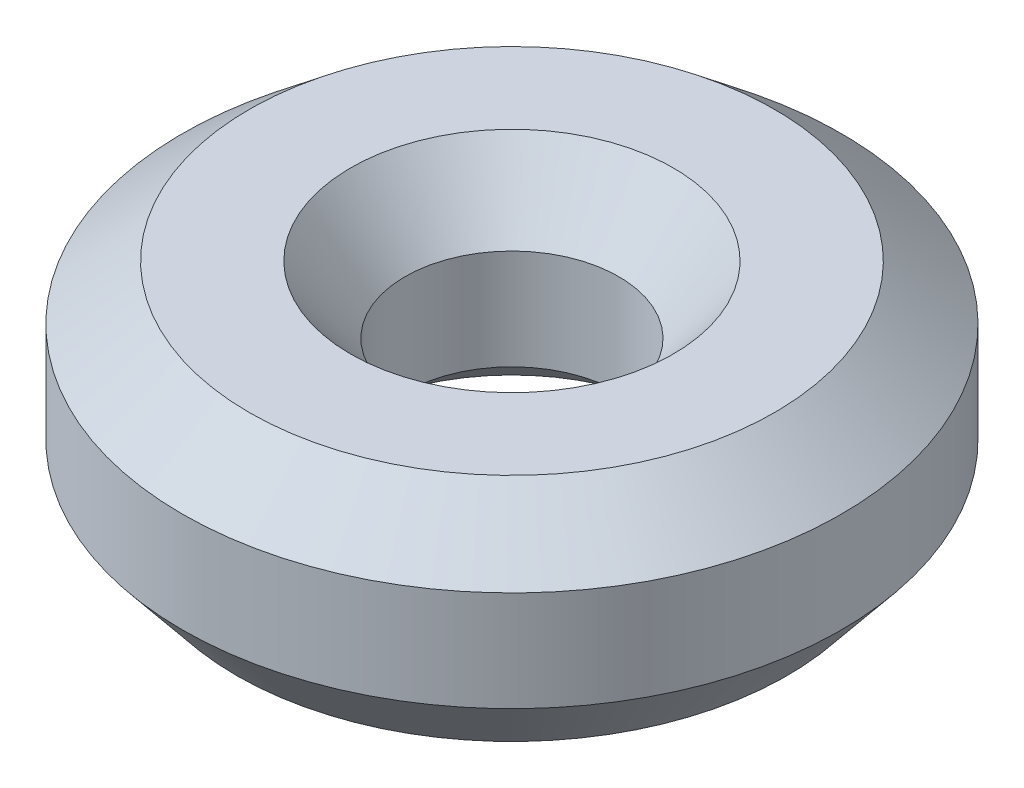
from build123d import *
from OCP.BRepFilletAPI import BRepFilletAPI_MakeChamfer

# Parameters (mm, degrees)
SKETCH1_R           = 10
BOSS_EXTRUDE1_DEPTH = 6.726150049
SKETCH2_R           = 3.242439073
CUT_EXTRUDE1_DEPTH  = 16.660175429
CHAMFER1_SIZE       = 1.652575241
CHAMFER1_SIZE2      = 2.031539036


with BuildPart() as part:
    # Sketch1 → Boss-Extrude1 (new body)
    with BuildSketch(Plane(origin=(0, 0, 0), x_dir=(1, 0, 0), z_dir=(0, 1, 0))):
        Circle(SKETCH1_R)
    extrude(amount=BOSS_EXTRUDE1_DEPTH)

    # Sketch2 → Cut-Extrude1 (cut, through all)
    with BuildSketch(Plane(origin=(0, 0, 0), x_dir=(1, 0, 0), z_dir=(0, 1, 0))):
        Circle(SKETCH2_R)
    extrude(amount=CUT_EXTRUDE1_DEPTH, mode=Mode.SUBTRACT)

    # Chamfer1: one chamfer whose edges measure the first distance from different faces: ONE call of the kernel's chamfer builder (chamfer() names one face for all edges)
    chamfer1_edges_1 = [part.edges().sort_by_distance(p)[0] for p in [
        (-3.242439073, 6.726150049, 0),
    ]]
    chamfer1_side_1 = [part.faces().sort_by_distance(p)[0] for p in [
        (-9.717157288, 6.726150049, 0),
    ]]
    chamfer1_edges_2 = [part.edges().sort_by_distance(p)[0] for p in [
        (-3.242439073, 0, 0),
    ]]
    chamfer1_side_2 = [part.faces().sort_by_distance(p)[0] for p in [
        (-3.242439073, 3.363075025, 0),
    ]]
    chamfer1_edges_3 = [part.edges().sort_by_distance(p)[0] for p in [
        (-10, 0, 0),
    ]]
    chamfer1_side_3 = [part.faces().sort_by_distance(p)[0] for p in [
        (-9.717157288, 0, 0),
    ]]
    chamfer1_edges_4 = [part.edges().sort_by_distance(p)[0] for p in [
        (-10, 6.726150049, 0),
    ]]
    chamfer1_side_4 = [part.faces().sort_by_distance(p)[0] for p in [
        (-10, 3.363075025, 0),
    ]]
    chamfer1 = BRepFilletAPI_MakeChamfer(part.part.solid().wrapped)
    for e in chamfer1_edges_1:
        chamfer1.Add(CHAMFER1_SIZE, CHAMFER1_SIZE2, e.wrapped, chamfer1_side_1[0].wrapped)  # the first distance lies on this face
    for e in chamfer1_edges_2:
        chamfer1.Add(CHAMFER1_SIZE, CHAMFER1_SIZE2, e.wrapped, chamfer1_side_2[0].wrapped)  # the first distance lies on this face
    for e in chamfer1_edges_3:
        chamfer1.Add(CHAMFER1_SIZE, CHAMFER1_SIZE2, e.wrapped, chamfer1_side_3[0].wrapped)  # the first distance lies on this face
    for e in chamfer1_edges_4:
        chamfer1.Add(CHAMFER1_SIZE, CHAMFER1_SIZE2, e.wrapped, chamfer1_side_4[0].wrapped)  # the first distance lies on this face
    add(Compound.cast(chamfer1.Shape()), mode=Mode.REPLACE)


solid = part.part
